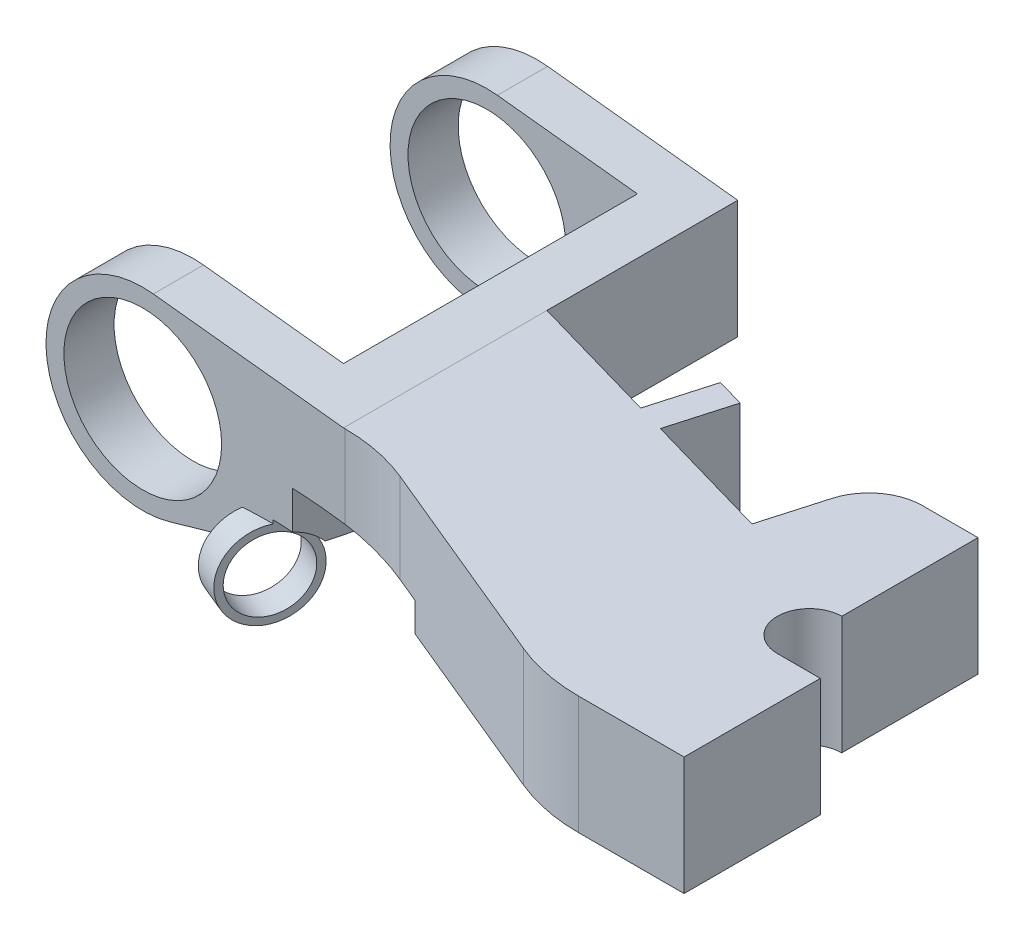
from build123d import *

# Parameters (mm, degrees)
EXTRUDE_1_DEPTH          = 13.5
CUT_EXTRUDE_1_DEPTH      = 136.073128342
CUT_EXTRUDE_1_DEPTH_BACK = 136.073128342
SKETCH_11_R              = 11
SKETCH_12_R              = 2.5
EXTRUDE_2_DEPTH          = 4.5
SKETCH_13_R              = 2.5
EXTRUDE_3_DEPTH          = 4.5
FILLET_1_R               = 25
SKETCH_15_R              = 6
SKETCH_15_R_2            = 5
EXTRUDE_4_DEPTH          = 4
CUT_EXTRUDE_START        = -4
SKETCH_19_R              = 5
CUT_EXTRUDE_3_DEPTH      = 4
CUT_EXTRUDE_START_2      = -0.5
SKETCH_20_R              = 5
CUT_EXTRUDE_4_DEPTH      = 0.5


with BuildPart() as part:
    # Эскиз10 → Бобышка-Вытянуть1 (new, symmetric)
    with BuildSketch(Plane(origin=(0, 0, 0), x_dir=(1, 0, 0), z_dir=(0, 1, 0))):
        with BuildLine():
            Line((-78, 61.5), (-92.5, 61.5))
            Line((-92.5, 61.5), (-119.5, 61.5))
            Line((-119.5, 61.5), (-119.5, 54.5))
            Line((-119.5, 54.5), (-92.5, 54.5))
            Line((-92.5, 54.5), (-85, 54.5))
            Line((-85, 54.5), (-85, 13.5))
            Line((-85, 13.5), (-92.5, 13.5))
            Line((-92.5, 13.5), (-119.5, 13.5))
            Line((-119.5, 13.5), (-119.5, 6.5))
            Line((-119.5, 6.5), (-92.5, 6.5))
            Line((-92.5, 6.5), (-72.806349184, 6.5))
            Line((-72.806349184, 6.5), (-53.492640685, -1.5))
            Line((-53.492640685, -1.5), (-34.178932186, -9.5))
            Line((-34.178932186, -9.5), (-14.48528137, -9.5))
            Line((-14.48528137, -9.5), (-14.48528137, 9.5))
            Line((-14.48528137, 9.5), (-20.48528137, 9.5))
            ThreePointArc((-20.48528137, 9.5), (-24.98528137, 14), (-20.48528137, 18.5))
            Line((-20.48528137, 18.5), (-20.48528137, 37.5))
            Line((-20.48528137, 37.5), (-28.16726189, 37.5))
            ThreePointArc((-28.16726189, 37.5), (-32.706687221, 35.981129531), (-35.41795442, 32.036211278))
            Line((-35.41795442, 32.036211278), (-37.898690622, 23.384856014))
            Line((-37.898690622, 23.384856014), (-55.820093902, 28.523735711))
            Line((-55.820093902, 28.523735711), (-53.3393577, 37.175090975))
            Line((-53.3393577, 37.175090975), (-57.184404484, 38.277640398))
            Line((-57.184404484, 38.277640398), (-59.665140686, 29.626285135))
            Line((-59.665140686, 29.626285135), (-78, 34.883721442))
            Line((-78, 34.883721442), (-78, 61.5))
        make_face()
    extrude(amount=EXTRUDE_1_DEPTH, both=True)

    # Эскиз11 → Вырез-Вытянуть1 (cut, two sides: drawn at the far end of the back side and taken through both)
    with BuildSketch(Plane.XY.offset(-CUT_EXTRUDE_1_DEPTH_BACK)):
        with BuildLine():
            Line((-11.66726189, -13.5), (-11.66726189, -6))
            Line((-11.66726189, -6), (-78, -6))
            Line((-78, -6), (-102.271403318, -12.974882149))
            ThreePointArc((-102.271403318, -12.974882149), (-104.117303664, -13.368075946), (-106, -13.5))
            Line((-106, -13.5), (-11.66726189, -13.5))
        make_face()
        with BuildLine():
            Line((-78, 10.5), (-11.66726189, 10.5))
            Line((-11.66726189, 10.5), (-11.66726189, 13.5))
            Line((-11.66726189, 13.5), (-106, 13.5))
            ThreePointArc((-106, 13.5), (-105.260484121, 13.479729829), (-104.523188999, 13.418980187))
            Line((-104.523188999, 13.418980187), (-78, 10.5))
        make_face()
        with BuildLine():
            Line((-119.5, -13.5), (-106, -13.5))
            ThreePointArc((-106, -13.5), (-115.545941546, -9.545941546), (-119.5, 0))
            Line((-119.5, 0), (-119.5, -13.5))
        make_face()
        with BuildLine():
            ThreePointArc((-119.5, 0), (-115.545941546, 9.545941546), (-106, 13.5))
            Line((-106, 13.5), (-119.5, 13.5))
            Line((-119.5, 13.5), (-119.5, 0))
        make_face()
        with Locations((-106, 0)):
            Circle(SKETCH_11_R)
    extrude(amount=CUT_EXTRUDE_1_DEPTH + CUT_EXTRUDE_1_DEPTH_BACK, mode=Mode.SUBTRACT)

    # Эскиз12 → Бобышка-Вытянуть2 (add)
    with BuildSketch(Plane(origin=(-62.981794436, 0, -18.059738941), x_dir=(-0.2756373558168036, 0, 0.961261695938375), z_dir=(-0.961261695938375, 0, -0.2756373558168036))):
        with Locations((-18.53267148, 0)):
            Circle(SKETCH_12_R)
    extrude(amount=EXTRUDE_2_DEPTH)

    # Эскиз13 → Бобышка-Вытянуть3 (add)
    with BuildSketch(Plane(origin=(-41.215344372, 0, -11.818309821), x_dir=(-0.2756373558168751, 0, 0.9612616959383545), z_dir=(-0.9612616959383545, 0, -0.2756373558168751))):
        with Locations((-18.53267148, 0)):
            Circle(SKETCH_13_R)
    extrude(amount=EXTRUDE_3_DEPTH)

    # Скругление1
    fillet_1_edges = [part.edges().sort_by_distance(p)[0] for p in [
        (-34.178932186, 2.25, 9.5),
        (-72.806349184, 2.25, -6.5),
    ]]
    fillet(fillet_1_edges, radius=FILLET_1_R)

    # Эскиз15 → Бобышка-Вытянуть4 (add)
    with BuildSketch(Plane(origin=(-80.941518, 0, -33.527074515), x_dir=(-0.38268343236509056, 0, 0.9238795325112865), z_dir=(-0.9238795325112865, 0, -0.38268343236509056))):
        with Locations((27.935890563, -12)):
            Circle(SKETCH_15_R)
        with Locations((27.935890563, -12)):
            Circle(SKETCH_15_R_2, mode=Mode.SUBTRACT)
    extrude(amount=-EXTRUDE_4_DEPTH)

    # Эскиз18 → Вырез-Повернуть2 (revolve, cut)
    with BuildSketch(Plane(origin=(-9.7155037, -16.034421878, 23.455300799), x_dir=(0.9462095031073392, -0.1825979190952245, 0.2671059268744448), z_dir=(-0.3235545954384861, -0.5339929913879853, 0.7811298924757322))):
        Polygon((-63.074879802, 2.955443363), (-69.416732567, 1.552707093), (-77.238099443, -0.177278672), (-82.761455362, -1.398973967), (-81.630628663, -6.511507649), (-84.071630178, -7.051425791), (-83.96364655, -7.539626094), (-82.667843009, -13.398029732), (-60.540265933, -8.50369426), (-61.51669247, -4.089212746), (-62.247084147, -0.787069235), align=None)
    revolve(axis=Axis((-87.936602357, -12, -6.186943272), (0.9238795325112863, 0, 0.3826834323650908)), mode=Mode.SUBTRACT)

    # Эскиз19 → Вырез-Вытянуть3 (cut)
    with BuildSketch(Plane(origin=(-77.24599987, 0, -31.996340785), x_dir=(0.3826834323650906, 0, -0.9238795325112865), z_dir=(0.9238795325112865, 0, 0.3826834323650906)).offset(CUT_EXTRUDE_START)):
        with Locations((-27.935890563, -12)):
            Circle(SKETCH_19_R)
    extrude(amount=CUT_EXTRUDE_3_DEPTH, mode=Mode.SUBTRACT)

    # Эскиз20 → Вырез-Вытянуть4 (cut)
    with BuildSketch(Plane(origin=(-80.941518, 0, -33.527074515), x_dir=(0.38268343236509067, 0, -0.9238795325112864), z_dir=(0.9238795325112864, 0, 0.38268343236509067)).offset(CUT_EXTRUDE_START_2)):
        with Locations((-27.935890563, -12)):
            Circle(SKETCH_20_R)
    extrude(amount=CUT_EXTRUDE_4_DEPTH, mode=Mode.SUBTRACT)


solid = part.part
